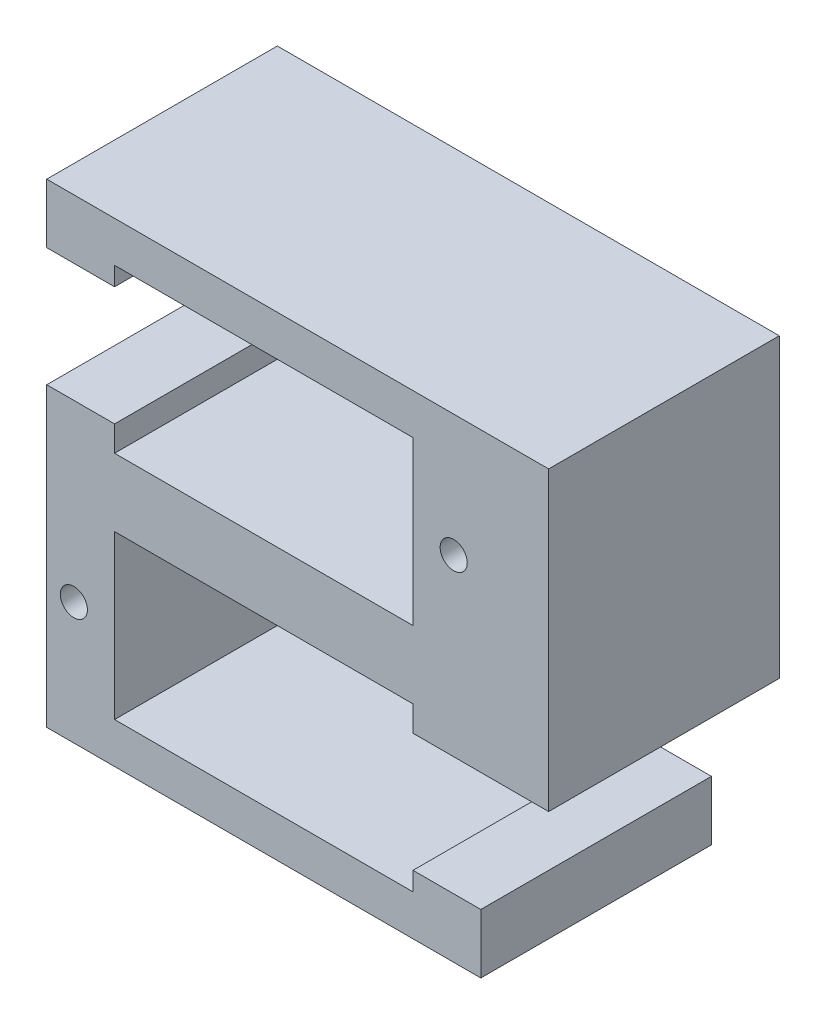
from build123d import *

# Parameters (mm, degrees)
SKETCH2_W           = 32.000000477
SKETCH2_H           = 35
SKETCH2_W_2         = 22
SKETCH2_H_2         = 12
BOSS_EXTRUDE1_DEPTH = 35
SKETCH3_W           = 15
SKETCH3_H           = 35
CUT_EXTRUDE1_DEPTH  = 90.56534365
CUT_EXTRUDE2_REACH  = 91.565
SKETCH4_W           = 20
SKETCH4_H           = 8.75
CUT_EXTRUDE3_REACH  = 91.565
SKETCH5_W           = 20
SKETCH5_H           = 8.75
SKETCH6_W           = 3
SKETCH6_H           = 35
CUT_EXTRUDE4_DEPTH  = 90.56534365
SKETCH7_W           = 17
SKETCH7_H           = 21.875
BOSS_EXTRUDE2_DEPTH = 5
SKETCH11_R          = 1
CUT_EXTRUDE5_DEPTH  = 10


with BuildPart() as part:
    # Sketch2 → Boss-Extrude1 (new body)
    with BuildSketch(Plane.XY):
        with Locations((0.112238017, 58.479936513)):
            Rectangle(SKETCH2_W, SKETCH2_H)
        with Locations((0.112238016, 49.979936513)):
            Rectangle(SKETCH2_W_2, SKETCH2_H_2, mode=Mode.SUBTRACT)
        Polygon((11.112238016, 60.979936513), (-10.887761984, 60.979936513), (-10.887761984, 72.979936603), (11.112238016, 72.979936513), align=None, mode=Mode.SUBTRACT)
    extrude(amount=-BOSS_EXTRUDE1_DEPTH)

    # Sketch3 → Cut-Extrude1 (cut, through all)
    with BuildSketch(Plane(origin=(16.112238255, 0, 0), x_dir=(0, 0, -1), z_dir=(1, 0, 0))):
        with Locations((7.5, 58.479936513)):
            Rectangle(SKETCH3_W, SKETCH3_H)
    extrude(amount=-CUT_EXTRUDE1_DEPTH, mode=Mode.SUBTRACT)

    # Sketch4 → Cut-Extrude2 (cut, up to next)
    with BuildSketch(Plane.ZY.offset(15.887762222), mode=Mode.PRIVATE) as cut_extrude2_sk1:
        with Locations((-25, 67.229936513)):
            Rectangle(SKETCH4_W, SKETCH4_H)
    cut_extrude2_tool1 = extrude(cut_extrude2_sk1.sketch, amount=-CUT_EXTRUDE2_REACH, mode=Mode.PRIVATE) & part.part
    add(cut_extrude2_tool1.solids().sort_by_distance((-15.887762, 67.229937, -25))[0], mode=Mode.SUBTRACT)

    # Sketch5 → Cut-Extrude3 (cut, up to next)
    with BuildSketch(Plane(origin=(16.112238255, 0, 0), x_dir=(0, 0, -1), z_dir=(1, 0, 0)), mode=Mode.PRIVATE) as cut_extrude3_sk1:
        with Locations((25, 49.729936513)):
            Rectangle(SKETCH5_W, SKETCH5_H)
    cut_extrude3_tool1 = extrude(cut_extrude3_sk1.sketch, amount=-CUT_EXTRUDE3_REACH, mode=Mode.PRIVATE) & part.part
    add(cut_extrude3_tool1.solids().sort_by_distance((16.112238, 49.729937, -25))[0], mode=Mode.SUBTRACT)

    # Sketch6 → Cut-Extrude4 (cut, through all)
    with BuildSketch(Plane.ZY.offset(15.887762222)):
        with Locations((-33.5, 58.479936513)):
            Rectangle(SKETCH6_W, SKETCH6_H)
    extrude(amount=-CUT_EXTRUDE4_DEPTH, mode=Mode.SUBTRACT)

    # Sketch7 → Boss-Extrude2 (add)
    with BuildSketch(Plane(origin=(16.112238255, 0, 0), x_dir=(0, 0, -1), z_dir=(1, 0, 0))):
        with Locations((23.5, 65.042436513)):
            Rectangle(SKETCH7_W, SKETCH7_H)
    extrude(amount=BOSS_EXTRUDE2_DEPTH)

    # Sketch11 → Cut-Extrude5 (cut)
    with BuildSketch(Plane.XY.offset(-15)):
        with Locations((14.112238255, 66.979936513)):
            Circle(SKETCH11_R)
        with Locations((-13.887762222, 49.979936513)):
            Circle(SKETCH11_R)
    extrude(amount=-CUT_EXTRUDE5_DEPTH, mode=Mode.SUBTRACT)


solid = part.part
